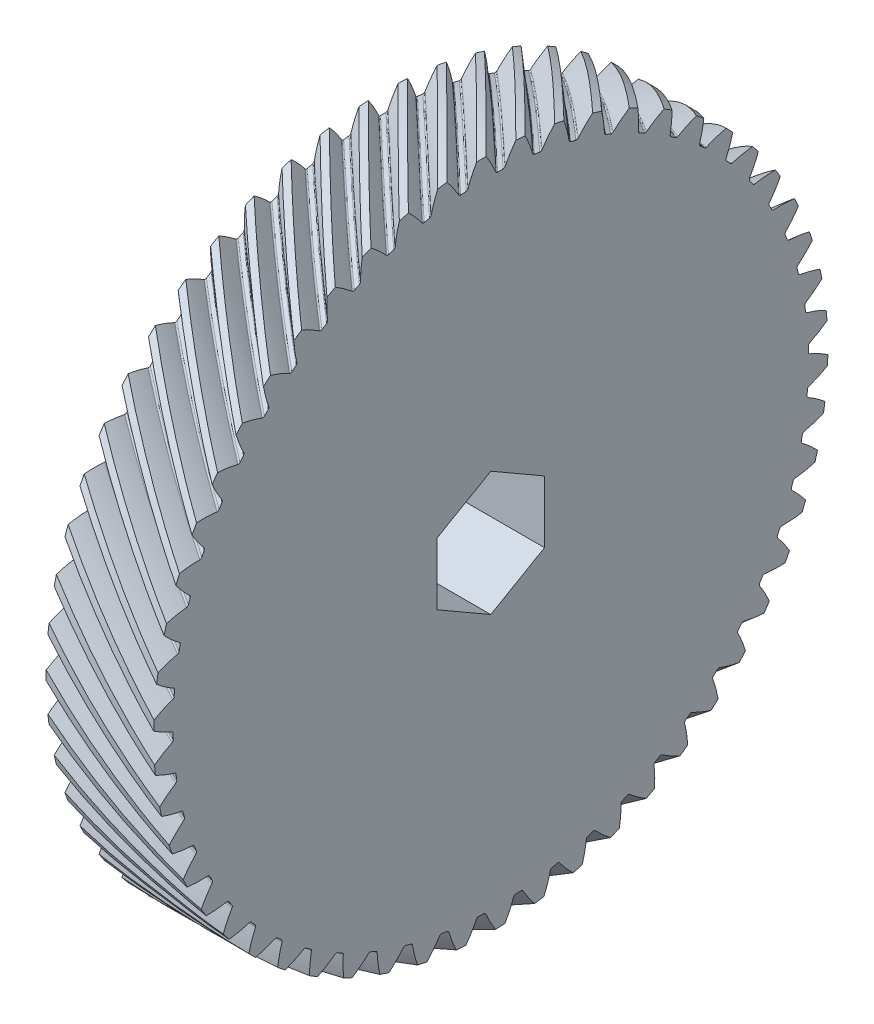
from build123d import *

# Parameters (mm, degrees)
BASPROSKE_W              = 5
BASPROSKE_H              = 15.673506474
TOOTHCUTRH_PITCH         = 98.479545587
TOOTHCUTRH_HEIGHT        = 5
TOOTHCUTRH_RADIUS        = 15.673506474
TOOTHCUTRH_START_ANGLE   = -90
TEETHCUTSRH_COUNT        = 54
TEETHCUTSRH_ANGLE        = 353.333333333
BORSKE_R                 = 2
BORE_DEPTH               = 62.5000025
TAGLIO_ESTRUSIONE1_DEPTH = 10


with BuildPart() as part:
    # BasProSke → Base-Revolve (revolve)
    with BuildSketch(Plane(origin=(0, 0, 0), x_dir=(1, 0, 0), z_dir=(0, 1, 0)), mode=Mode.PRIVATE) as base_revolve_sk:
        with Locations((2.5, 7.836753237)):
            Rectangle(BASPROSKE_W, BASPROSKE_H)
    revolve(base_revolve_sk.sketch.rotate(Axis((-10, 0, 0), (1, 0, 0)), 180), axis=Axis((-10, 0, 0), (1, 0, 0)))

    # ToothCutRH: sweep along a helix
    with BuildLine() as toothcutrh_path:
        add(Helix(TOOTHCUTRH_PITCH, TOOTHCUTRH_HEIGHT, TOOTHCUTRH_RADIUS, center=(0, 0, 0), direction=(1, 0, 0), mode=Mode.PRIVATE).rotate(Axis((0, 0, 0), (1, 0, 0)), TOOTHCUTRH_START_ANGLE))
    # TooCutSkeRH → ToothCutRH (sweep, cut)
    with BuildSketch(Plane(origin=(0, 0, 0), x_dir=(0, 0, -1), z_dir=(1, 0, 0))):
        with BuildLine():
            ThreePointArc((0.126908319, 14.772961376), (0, 14.773506474), (-0.126908319, 14.772961376))
            ThreePointArc((-0.126908319, 14.772961376), (-0.181903273, 14.788686134), (-0.219538252, 14.831759575))
            ThreePointArc((-0.219538252, 14.831759575), (-0.58603513, 15.499999599), (-1.042960592, 16.109986332))
            ThreePointArc((-1.042960592, 16.109986332), (0, 16.143711668), (1.042960592, 16.109986332))
            ThreePointArc((1.042960592, 16.109986332), (0.58603513, 15.499999599), (0.219538252, 14.831759575))
            ThreePointArc((0.219538252, 14.831759575), (0.181903273, 14.788686134), (0.126908319, 14.772961376))
        make_face()
    toothcutrh = sweep(path=toothcutrh_path.line, is_frenet=True, mode=Mode.SUBTRACT)

    # TeethCutsRH: ToothCutRH ×54 about axis
    teethcutsrh_axis = Axis((-10, 0, 0), (1, 0, 0))
    for i in range(1, TEETHCUTSRH_COUNT):
        add(toothcutrh.rotate(teethcutsrh_axis, i * TEETHCUTSRH_ANGLE / (TEETHCUTSRH_COUNT - 1)), mode=Mode.SUBTRACT)

    # BorSke → Bore (cut, symmetric)
    with BuildSketch(Plane(origin=(0, 0, 0), x_dir=(0, 0, -1), z_dir=(1, 0, 0))):
        with Locations(Location((0, 0, 0), (0, 0, 180))):
            Circle(BORSKE_R)
    extrude(amount=BORE_DEPTH, both=True, mode=Mode.SUBTRACT)

    # Schizzo1 → Taglio-Estrusione1 (cut)
    with BuildSketch(Plane(origin=(5, 0, 0), x_dir=(0, 0, -1), z_dir=(1, 0, 0))):
        Polygon((0, 2.886751346), (-2.5, 1.443375673), (-2.5, -1.443375673), (0, -2.886751346), (2.5, -1.443375673), (2.5, 1.443375673), align=None)
    extrude(amount=-TAGLIO_ESTRUSIONE1_DEPTH, mode=Mode.SUBTRACT)


solid = part.part
